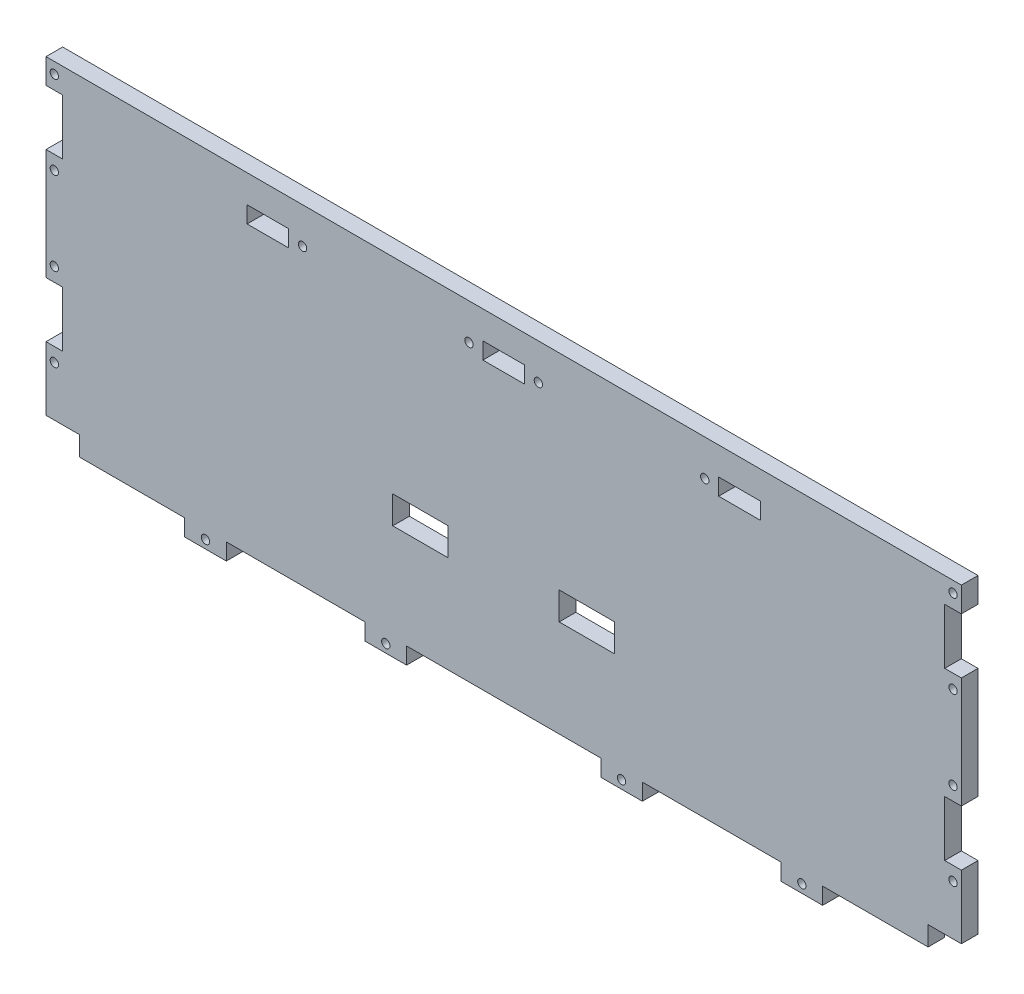
from build123d import *

# Parameters (mm, degrees)
ESQUISSE1_W             = 330
ESQUISSE1_H             = 238
ESQUISSE1_W_2           = 15
ESQUISSE1_H_2           = 6
ESQUISSE1_W_3           = 20
ESQUISSE1_H_3           = 10
BOSS_EXTRU_1_DEPTH      = 6
ESQUISSE2_W             = 15
ESQUISSE2_H             = 6
BOSS_EXTRU_2_DEPTH      = 6
ESQUISSE3_W             = 6
ESQUISSE3_H             = 20
ESQUISSE3_W_2           = 12
ESQUISSE3_H_2           = 7
ENL_V_MAT_EXTRU_1_DEPTH = 6
ESQUISSE4_R             = 1.5
ENL_V_MAT_EXTRU_2_DEPTH = 6
ESQUISSE5_W             = 356.185915781
ESQUISSE5_H             = 137.143349898
ENL_V_MAT_EXTRU_3_DEPTH = 6


with BuildPart() as part:
    # Esquisse1 → Boss.-Extru.1 (new body)
    with BuildSketch(Plane.XY):
        Rectangle(ESQUISSE1_W, ESQUISSE1_H)
        with Locations((-85, -13)):
            Rectangle(ESQUISSE1_W_2, ESQUISSE1_H_2, mode=Mode.SUBTRACT)
        with Locations((0, -13)):
            Rectangle(ESQUISSE1_W_2, ESQUISSE1_H_2, mode=Mode.SUBTRACT)
        with Locations((85, -13)):
            Rectangle(ESQUISSE1_W_2, ESQUISSE1_H_2, mode=Mode.SUBTRACT)
        with Locations((30, -79)):
            Rectangle(ESQUISSE1_W_3, ESQUISSE1_H_3, mode=Mode.SUBTRACT)
        with Locations((-30, -79)):
            Rectangle(ESQUISSE1_W_3, ESQUISSE1_H_3, mode=Mode.SUBTRACT)
    extrude(amount=BOSS_EXTRU_1_DEPTH)

    # Esquisse2 → Boss.-Extru.2 (add)
    with BuildSketch(Plane.XY.offset(6)):
        with Locations((107.5, -122)):
            Rectangle(ESQUISSE2_W, ESQUISSE2_H)
        with Locations((42.5, -122)):
            Rectangle(ESQUISSE2_W, ESQUISSE2_H)
        with Locations((-42.5, -122)):
            Rectangle(ESQUISSE2_W, ESQUISSE2_H)
        with Locations((-107.5, -122)):
            Rectangle(ESQUISSE2_W, ESQUISSE2_H)
    extrude(amount=-BOSS_EXTRU_2_DEPTH)

    # Esquisse3 → Enlèv. mat.-Extru.1 (cut)
    with BuildSketch(Plane.XY.offset(6)):
        with Locations((-162, 79)):
            Rectangle(ESQUISSE3_W, ESQUISSE3_H)
        with Locations((-162, 19)):
            Rectangle(ESQUISSE3_W, ESQUISSE3_H)
        with Locations((-162, -19)):
            Rectangle(ESQUISSE3_W, ESQUISSE3_H)
        with Locations((-162, -79)):
            Rectangle(ESQUISSE3_W, ESQUISSE3_H)
        with Locations((162, -79)):
            Rectangle(ESQUISSE3_W, ESQUISSE3_H)
        with Locations((162, -19)):
            Rectangle(ESQUISSE3_W, ESQUISSE3_H)
        with Locations((162, 19)):
            Rectangle(ESQUISSE3_W, ESQUISSE3_H)
        with Locations((162, 79)):
            Rectangle(ESQUISSE3_W, ESQUISSE3_H)
        with Locations((159, -115.5)):
            Rectangle(ESQUISSE3_W_2, ESQUISSE3_H_2)
        with Locations((-159, -115.5)):
            Rectangle(ESQUISSE3_W_2, ESQUISSE3_H_2)
    extrude(amount=-ENL_V_MAT_EXTRU_1_DEPTH, mode=Mode.SUBTRACT)

    # Esquisse4 → Enlèv. mat.-Extru.2 (cut)
    with BuildSketch(Plane.XY.offset(6)):
        with Locations((-162, 114)):
            Circle(ESQUISSE4_R)
        with Locations((-162, 94)):
            Circle(ESQUISSE4_R)
        with Locations((-162, 64)):
            Circle(ESQUISSE4_R)
        with Locations((-162, 34)):
            Circle(ESQUISSE4_R)
        with Locations((-162, 4)):
            Circle(ESQUISSE4_R)
        with Locations((-107.5, -122)):
            Circle(ESQUISSE4_R)
        with Locations((-162, -4)):
            Circle(ESQUISSE4_R)
        with Locations((-162, -34)):
            Circle(ESQUISSE4_R)
        with Locations((-162, -64)):
            Circle(ESQUISSE4_R)
        with Locations((-162, -94)):
            Circle(ESQUISSE4_R)
        with Locations((-42.5, -122)):
            Circle(ESQUISSE4_R)
        with Locations((-72.5, -13)):
            Circle(ESQUISSE4_R)
        with Locations((162, -94)):
            Circle(ESQUISSE4_R)
        with Locations((162, -64)):
            Circle(ESQUISSE4_R)
        with Locations((162, -34)):
            Circle(ESQUISSE4_R)
        with Locations((162, -4)):
            Circle(ESQUISSE4_R)
        with Locations((42.5, -122)):
            Circle(ESQUISSE4_R)
        with Locations((162, 4)):
            Circle(ESQUISSE4_R)
        with Locations((162, 34)):
            Circle(ESQUISSE4_R)
        with Locations((162, 64)):
            Circle(ESQUISSE4_R)
        with Locations((162, 94)):
            Circle(ESQUISSE4_R)
        with Locations((162, 114)):
            Circle(ESQUISSE4_R)
        with Locations((-12.5, -13)):
            Circle(ESQUISSE4_R)
        with Locations((12.5, -13)):
            Circle(ESQUISSE4_R)
        with Locations((72.5, -13)):
            Circle(ESQUISSE4_R)
        with Locations((107.5, -122)):
            Circle(ESQUISSE4_R)
    extrude(amount=-ENL_V_MAT_EXTRU_2_DEPTH, mode=Mode.SUBTRACT)

    # Esquisse5 → Enlèv. mat.-Extru.3 (cut)
    with BuildSketch(Plane.XY.offset(6)):
        with Locations((3.094759514, 68.571674949)):
            Rectangle(ESQUISSE5_W, ESQUISSE5_H)
    extrude(amount=-ENL_V_MAT_EXTRU_3_DEPTH, mode=Mode.SUBTRACT)


solid = part.part
